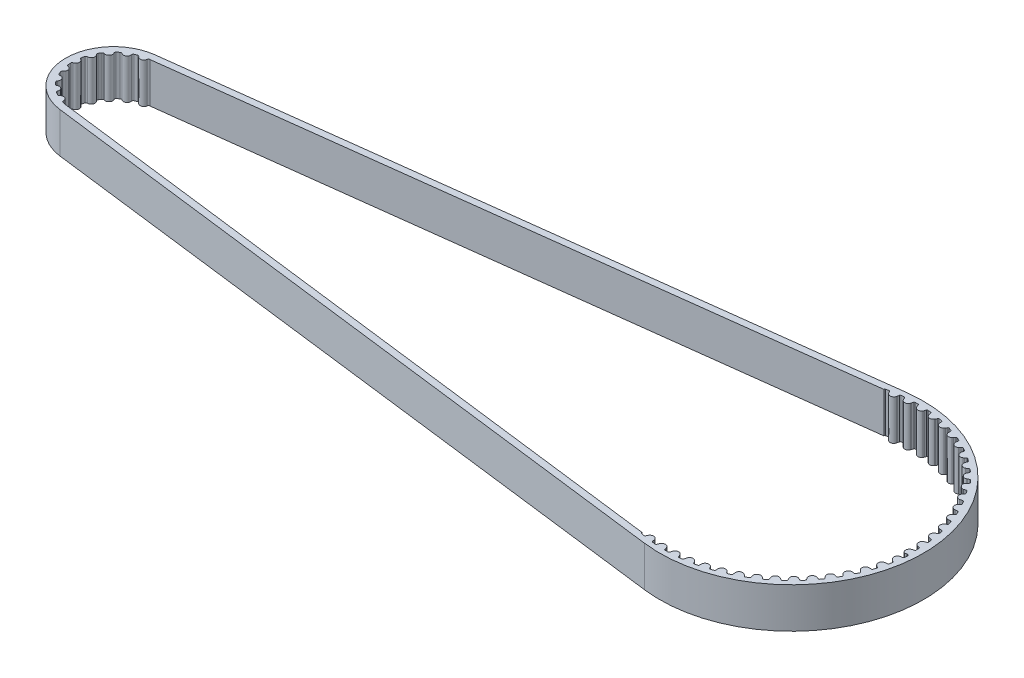
from build123d import *

# Parameters (mm, degrees)
BOSS_EXTRUDE1_DEPTH = 6


with BuildPart() as part:
    # Sketch1 → Boss-Extrude1 (new body)
    with BuildSketch(Plane(origin=(0, 0, 0), x_dir=(1, 0, 0), z_dir=(0, 1, 0))):
        with BuildLine():
            Line((98.570063965, 19.477466473), (-0.882050741, 7.070191758))
            ThreePointArc((-0.882050741, 7.070191758), (-7.125, 0), (-0.882050741, -7.070191758))
            Line((-0.882050741, -7.070191758), (98.570063965, -19.477466473))
            ThreePointArc((98.570063965, -19.477466473), (120.628456112, 0), (98.570063965, 19.477466473))
        make_face()
        with BuildLine():
            Line((96.532322207, 18.196676293), (96.5324945, 18.200875448))
            ThreePointArc((96.5324945, 18.200875448), (96.566624796, 18.290137922), (96.647734989, 18.340673087))
            ThreePointArc((96.647734989, 18.340673087), (96.85864329, 18.38944438), (97.070097766, 18.43579042))
            ThreePointArc((97.070097766, 18.43579042), (97.165040528, 18.424902897), (97.23413974, 18.358888011))
            Line((97.23413974, 18.358888011), (97.271031693, 18.288715761))
            Line((97.271031693, 18.288715761), (97.340377643, 18.156812707))
            ThreePointArc((97.340377643, 18.156812707), (97.374757011, 18.096586899), (97.413227715, 18.0388886))
            ThreePointArc((97.413227715, 18.0388886), (97.957473201, 17.815522628), (98.396741197, 18.206852582))
            ThreePointArc((98.396741197, 18.206852582), (98.413882561, 18.274048285), (98.426325649, 18.34227041))
            Line((98.426325649, 18.34227041), (98.459477503, 18.568150633))
            ThreePointArc((98.459477503, 18.568150633), (98.502751299, 18.65335653), (98.588699526, 18.695136534))
            ThreePointArc((98.588699526, 18.695136534), (98.803550437, 18.721594732), (99.018691023, 18.745583873))
            ThreePointArc((99.018691023, 18.745583873), (99.111975623, 18.724831772), (99.173795868, 18.651955687))
            Line((99.173795868, 18.651955687), (99.258329168, 18.439882488))
            ThreePointArc((99.258329168, 18.439882488), (99.28622489, 18.376392981), (99.318453734, 18.314989476))
            ThreePointArc((99.318453734, 18.314989476), (99.836369683, 18.035957982), (100.314136442, 18.379228181))
            ThreePointArc((100.314136442, 18.379228181), (100.338207768, 18.444264018), (100.357713845, 18.510811759))
            Line((100.357713845, 18.510811759), (100.414295003, 18.731989273))
            ThreePointArc((100.414295003, 18.731989273), (100.466238181, 18.812205061), (100.556082774, 18.844772153))
            ThreePointArc((100.556082774, 18.844772153), (100.772522345, 18.848627375), (100.988991916, 18.849996786))
            ThreePointArc((100.988991916, 18.849996786), (101.079596309, 18.819607471), (101.13346027, 18.740668634))
            Line((101.13346027, 18.740668634), (101.195362802, 18.520921058))
            ThreePointArc((101.195362802, 18.520921058), (101.216469248, 18.454863456), (101.242103125, 18.390427494))
            ThreePointArc((101.242103125, 18.390427494), (101.728015143, 18.058787606), (102.239046152, 18.350237109))
            ThreePointArc((102.239046152, 18.350237109), (102.269783709, 18.412400535), (102.296139063, 18.47654478))
            Line((102.296139063, 18.47654478), (102.375529608, 18.690596319))
            ThreePointArc((102.375529608, 18.690596319), (102.43557307, 18.764943136), (102.528329673, 18.787940505))
            ThreePointArc((102.528329673, 18.787940505), (102.743986546, 18.769150512), (102.959413416, 18.747885189))
            ThreePointArc((102.959413416, 18.747885189), (103.04634492, 18.708191612), (103.091662454, 18.624054893))
            Line((103.091662454, 18.624054893), (103.130256001, 18.399040541))
            ThreePointArc((103.130256001, 18.399040541), (103.144341924, 18.331138585), (103.163099983, 18.264376141))
            ThreePointArc((103.163099983, 18.264376141), (103.611684317, 17.883761373), (104.150380614, 18.120197))
            ThreePointArc((104.150380614, 18.120197), (104.187447634, 18.178806939), (104.22036351, 18.23984491))
            Line((104.22036351, 18.23984491), (104.321693624, 18.444425281))
            ThreePointArc((104.321693624, 18.444425281), (104.38917952, 18.512088567), (104.483831872, 18.525264249))
            ThreePointArc((104.483831872, 18.525264249), (104.696343265, 18.484034908), (104.908367173, 18.440367839))
            ThreePointArc((104.908367173, 18.440367839), (104.990673348, 18.391804891), (105.026947946, 18.30339211))
            Line((105.026947946, 18.30339211), (105.041809669, 18.075576286))
            ThreePointArc((105.041809669, 18.075576286), (105.048720741, 18.006573924), (105.060397466, 17.93821646))
            ThreePointArc((105.060397466, 17.93821646), (105.466739331, 17.512796909), (106.027198846, 17.691628221))
            ThreePointArc((106.027198846, 17.691628221), (106.070189215, 17.746042529), (106.10930498, 17.803305482))
            Line((106.10930498, 17.803305482), (106.231464469, 17.996173259))
            ThreePointArc((106.231464469, 17.996173259), (106.30565341, 18.056411682), (106.40116448, 18.059621321))
            ThreePointArc((106.40116448, 18.059621321), (106.608202073, 17.996404349), (106.814500041, 17.93081396))
            ThreePointArc((106.814500041, 17.93081396), (106.891279124, 17.873913707), (106.918113353, 17.782193532))
            Line((106.918113353, 17.782193532), (106.909080424, 17.554072234))
            ThreePointArc((106.909080424, 17.554072234), (106.908740926, 17.484725471), (106.913208384, 17.415521926))
            ThreePointArc((106.913208384, 17.415521926), (107.272855814, 16.949958577), (107.848938035, 17.069226261))
            ThreePointArc((107.848938035, 17.069226261), (107.897380743, 17.118848764), (107.942267836, 17.171709314))
            Line((107.942267836, 17.171709314), (108.083918295, 17.350751398))
            ThreePointArc((108.083918295, 17.350751398), (108.16399745, 17.402904972), (108.2593208, 17.396113403))
            ThreePointArc((108.2593208, 17.396113403), (108.458616247, 17.311601419), (108.65692803, 17.224806331))
            ThreePointArc((108.65692803, 17.224806331), (108.727338813, 17.160192184), (108.744438673, 17.066169521))
            Line((108.744438673, 17.066169521), (108.711610058, 16.840242094))
            ThreePointArc((108.711610058, 16.840242094), (108.704023709, 16.771310707), (108.701232953, 16.702019289))
            ThreePointArc((108.701232953, 16.702019289), (109.010245576, 16.201412952), (109.595638826, 16.259810285))
            ThreePointArc((109.595638826, 16.259810285), (109.649003124, 16.30409731), (109.699169753, 16.351976305))
            Line((109.699169753, 16.351976305), (109.85875923, 16.515231073))
            ThreePointArc((109.85875923, 16.515231073), (109.943851236, 16.558728393), (110.037942482, 16.542010026))
            ThreePointArc((110.037942482, 16.542010026), (110.227312259, 16.437128961), (110.415465113, 16.33008012))
            ThreePointArc((110.415465113, 16.33008012), (110.478736161, 16.258460005), (110.485914301, 16.163164986))
            Line((110.485914301, 16.163164986), (110.429649678, 15.941906737))
            ThreePointArc((110.429649678, 15.941906737), (110.414899596, 15.874145952), (110.404881203, 15.805525834))
            ThreePointArc((110.404881203, 15.805525834), (110.659873411, 15.275361256), (111.248163999, 15.272248426))
            ThreePointArc((111.248163999, 15.272248426), (111.305865216, 15.310714754), (111.360761745, 15.353087622))
            Line((111.360761745, 15.353087622), (111.536541744, 15.49876642))
            ThreePointArc((111.536541744, 15.49876642), (111.625714316, 15.533130921), (111.717542575, 15.506668925))
            ThreePointArc((111.717542575, 15.506668925), (111.894911908, 15.382567878), (112.07084439, 15.256438133))
            ThreePointArc((112.07084439, 15.256438133), (112.126282492, 15.178596735), (112.123460268, 15.083073432))
            Line((112.123460268, 15.083073432), (112.044376084, 14.868908514))
            ThreePointArc((112.044376084, 14.868908514), (112.022623873, 14.803060733), (112.005487607, 14.73586373))
            ThreePointArc((112.005487607, 14.73586373), (112.203665652, 14.181949506), (112.788408143, 14.117360617))
            ThreePointArc((112.788408143, 14.117360617), (112.849814093, 14.149584803), (112.908839064, 14.185987298))
            Line((112.908839064, 14.185987298), (113.098883703, 14.312494039))
            ThreePointArc((113.098883703, 14.312494039), (113.191159846, 14.337349216), (113.279719028, 14.301433515))
            ThreePointArc((113.279719028, 14.301433515), (113.443144622, 14.159472162), (113.604929179, 14.015643417))
            ThreePointArc((113.604929179, 14.015643417), (113.651926943, 13.932433583), (113.639135276, 13.83772857))
            Line((113.639135276, 13.83772857), (113.538097993, 13.633003417))
            ThreePointArc((113.538097993, 13.633003417), (113.509581977, 13.569790083), (113.485515585, 13.50475242))
            ThreePointArc((113.485515585, 13.50475242), (113.624708187, 12.933157349), (114.199496021, 12.807800051))
            ThreePointArc((114.199496021, 12.807800051), (114.263933927, 12.833429039), (114.32644065, 12.863462328))
            Line((114.32644065, 12.863462328), (114.528667759, 12.969410979))
            ThreePointArc((114.528667759, 12.969410979), (114.623036477, 12.984484513), (114.70735631, 12.939508607))
            ThreePointArc((114.70735631, 12.939508607), (114.85504764, 12.781242307), (115.000911726, 12.62129038))
            ThreePointArc((115.000911726, 12.62129038), (115.038954236, 12.533623774), (115.016333273, 12.440774657))
            Line((115.016333273, 12.440774657), (114.894449877, 12.247732283))
            ThreePointArc((114.894449877, 12.247732283), (114.760660612, 12.124247056), (114.65147794, 11.978551097))
            ThreePointArc((114.65147794, 11.978551097), (114.805196208, 11.457814978), (115.288695756, 11.210785428))
            ThreePointArc((115.288695756, 11.210785428), (115.355459624, 11.229538423), (115.420763261, 11.252873455))
            Line((115.420763261, 11.252873455), (115.632957199, 11.337103219))
            ThreePointArc((115.632957199, 11.337103219), (115.728384569, 11.342229961), (115.807541227, 11.288686615))
            ThreePointArc((115.807541227, 11.288686615), (115.937880155, 11.115849367), (116.066225653, 10.941526724))
            ThreePointArc((116.066225653, 10.941526724), (116.094896106, 10.85036384), (116.062693688, 10.760387895))
            Line((116.062693688, 10.760387895), (115.92129956, 10.581143311))
            ThreePointArc((115.92129956, 10.581143311), (115.880263895, 10.525240153), (115.843201321, 10.466627403))
            ThreePointArc((115.843201321, 10.466627403), (115.860510934, 9.878583287), (116.396675026, 9.636460236))
            ThreePointArc((116.396675026, 9.636460236), (116.465033376, 9.648131775), (116.532418449, 9.664512887))
            Line((116.532418449, 9.664512887), (116.752254374, 9.726100925))
            ThreePointArc((116.752254374, 9.726100925), (116.847694873, 9.721224706), (116.920821099, 9.659700552))
            ThreePointArc((116.920821099, 9.659700552), (117.032379604, 9.474185996), (117.141800334, 9.287402554))
            ThreePointArc((117.141800334, 9.287402554), (117.160784612, 9.193742191), (117.119353554, 9.107625213))
            Line((117.119353554, 9.107625213), (116.959997837, 8.944142261))
            ThreePointArc((116.959997837, 8.944142261), (116.913343499, 8.892834741), (116.870357257, 8.838417172))
            ThreePointArc((116.870357257, 8.838417172), (116.826104698, 8.251785075), (117.334022877, 7.954943991))
            ThreePointArc((117.334022877, 7.954943991), (117.403226761, 7.9594062), (117.471954983, 7.968653915))
            Line((117.471954983, 7.968653915), (117.697024327, 8.006925456))
            ThreePointArc((117.697024327, 8.006925456), (117.79143229, 7.992099701), (117.857726897, 7.923268811))
            ThreePointArc((117.857726897, 7.923268811), (117.949282722, 7.727109484), (118.038579848, 7.529911681))
            ThreePointArc((118.038579848, 7.529911681), (118.047669953, 7.434780002), (117.997464184, 7.353465506))
            Line((117.997464184, 7.353465506), (117.821892813, 7.207535339))
            ThreePointArc((117.821892813, 7.207535339), (117.770130956, 7.161385593), (117.721692012, 7.111759415))
            ThreePointArc((117.721692012, 7.111759415), (117.616362122, 6.532966602), (118.090469529, 6.184659738))
            ThreePointArc((118.090469529, 6.184659738), (118.159760735, 6.181863726), (118.229079106, 6.183876727))
            Line((118.229079106, 6.183876727), (118.456915962, 6.198412459))
            ThreePointArc((118.456915962, 6.198412459), (118.549257035, 6.173799602), (118.607993686, 6.098416102))
            ThreePointArc((118.607993686, 6.098416102), (118.678543725, 5.893761167), (118.746738889, 5.688309542))
            ThreePointArc((118.746738889, 5.688309542), (118.74583523, 5.592748829), (118.687404814, 5.517127715))
            Line((118.687404814, 5.517127715), (118.497541384, 5.390349174))
            ThreePointArc((118.497541384, 5.390349174), (118.441239123, 5.349862829), (118.387878184, 5.305571756))
            ThreePointArc((118.387878184, 5.305571756), (118.222624979, 4.740959603), (118.657727195, 4.345003081))
            ThreePointArc((118.657727195, 4.345003081), (118.726346553, 4.334979483), (118.795495607, 4.329735713))
            Line((118.795495607, 4.329735713), (119.023603747, 4.320376381))
            ThreePointArc((119.023603747, 4.320376381), (119.112866221, 4.286246085), (119.163401385, 4.205135892))
            ThreePointArc((119.163401385, 4.205135892), (119.212172679, 3.994227591), (119.258518719, 3.782773115))
            ThreePointArc((119.258518719, 3.782773115), (119.247631196, 3.687830353), (119.181616309, 3.618731141))
            Line((119.181616309, 3.618731141), (118.979541005, 3.512493238))
            ThreePointArc((118.979541005, 3.512493238), (118.919315198, 3.47811387), (118.861616898, 3.439643166))
            ThreePointArc((118.861616898, 3.439643166), (118.638250926, 2.89539768), (119.029580881, 2.456129684))
            ThreePointArc((119.029580881, 2.456129684), (119.096776583, 2.43898832), (119.164998709, 2.426545232))
            Line((119.164998709, 2.426545232), (119.390878931, 2.393393378))
            ThreePointArc((119.390878931, 2.393393378), (119.476084829, 2.350119582), (119.517864832, 2.264171355))
            ThreePointArc((119.517864832, 2.264171355), (119.544323031, 2.049320444), (119.568312172, 1.834179858))
            ThreePointArc((119.568312172, 1.834179858), (119.54756007, 1.740895258), (119.474683986, 1.679075013))
            Line((119.474683986, 1.679075013), (119.262610787, 1.594541713))
            ThreePointArc((119.262610787, 1.594541713), (119.19912128, 1.566645991), (119.137717774, 1.534417147))
            ThreePointArc((119.137717774, 1.534417147), (118.85868628, 1.016501198), (119.201956479, 0.538734439))
            ThreePointArc((119.201956479, 0.538734439), (119.266992317, 0.514663113), (119.333540057, 0.495157036))
            Line((119.333540057, 0.495157036), (119.554717572, 0.438575878))
            ThreePointArc((119.554717572, 0.438575878), (119.634933359, 0.3866327), (119.667500452, 0.296788107))
            ThreePointArc((119.667500452, 0.296788107), (119.671355673, 0.080348536), (119.672725084, -0.136121035))
            ThreePointArc((119.672725084, -0.136121035), (119.642335769, -0.226725428), (119.563396932, -0.280589389))
            Line((119.563396932, -0.280589389), (119.343649357, -0.342491921))
            ThreePointArc((119.343649357, -0.342491921), (119.277591755, -0.363598367), (119.213155793, -0.389232244))
            ThreePointArc((119.213155793, -0.389232244), (118.881515904, -0.875144262), (119.172965408, -1.386175271))
            ThreePointArc((119.172965408, -1.386175271), (119.338152001, -1.347427553), (119.494410264, -1.281311355))
            Line((119.494410264, -1.281311355), (119.708461804, -1.3607019))
            ThreePointArc((119.708461804, -1.3607019), (119.78280862, -1.420745362), (119.80580599, -1.513501965))
            ThreePointArc((119.80580599, -1.513501965), (119.787015996, -1.729158838), (119.765750674, -1.944585708))
            ThreePointArc((119.765750674, -1.944585708), (119.726057097, -2.031517212), (119.641920378, -2.076834746))
            Line((119.641920378, -2.076834746), (119.416906026, -2.115428292))
            ThreePointArc((119.416906026, -2.115428292), (119.34900407, -2.129514216), (119.282241625, -2.148272275))
            ThreePointArc((119.282241625, -2.148272275), (118.901626858, -2.596856609), (119.138062485, -3.135552906))
            ThreePointArc((119.138062485, -3.135552906), (119.187547628, -3.179645652), (119.23984491, -3.22036351))
            Line((119.23984491, -3.22036351), (119.444425281, -3.321693624))
            ThreePointArc((119.444425281, -3.321693624), (119.512088567, -3.38917952), (119.525264249, -3.483831872))
            ThreePointArc((119.525264249, -3.483831872), (119.484034908, -3.696343265), (119.440367839, -3.908367173))
            ThreePointArc((119.440367839, -3.908367173), (119.391804891, -3.990673348), (119.30339211, -4.026947946))
            Line((119.30339211, -4.026947946), (119.075576286, -4.041809669))
            ThreePointArc((119.075576286, -4.041809669), (119.006573924, -4.048720741), (118.93821646, -4.060397466))
            ThreePointArc((118.93821646, -4.060397466), (118.512796909, -4.466739331), (118.691628221, -5.027198846))
            ThreePointArc((118.691628221, -5.027198846), (118.746042529, -5.070189215), (118.803305482, -5.10930498))
            Line((118.803305482, -5.10930498), (118.996173259, -5.231464469))
            ThreePointArc((118.996173259, -5.231464469), (119.056411682, -5.30565341), (119.059621321, -5.40116448))
            ThreePointArc((119.059621321, -5.40116448), (118.996404349, -5.608202073), (118.93081396, -5.814500041))
            ThreePointArc((118.93081396, -5.814500041), (118.873913707, -5.891279124), (118.782193532, -5.918113353))
            Line((118.782193532, -5.918113353), (118.554072234, -5.909080424))
            ThreePointArc((118.554072234, -5.909080424), (118.484725471, -5.908740926), (118.415521926, -5.913208384))
            ThreePointArc((118.415521926, -5.913208384), (117.949958577, -6.272855814), (118.069226261, -6.848938035))
            ThreePointArc((118.069226261, -6.848938035), (118.118848764, -6.897380743), (118.171709314, -6.942267836))
            Line((118.171709314, -6.942267836), (118.350751398, -7.083918295))
            ThreePointArc((118.350751398, -7.083918295), (118.402904972, -7.16399745), (118.396113403, -7.2593208))
            ThreePointArc((118.396113403, -7.2593208), (118.311601419, -7.458616247), (118.224806331, -7.65692803))
            ThreePointArc((118.224806331, -7.65692803), (118.160192184, -7.727338813), (118.066169521, -7.744438673))
            Line((118.066169521, -7.744438673), (117.840242094, -7.711610058))
            ThreePointArc((117.840242094, -7.711610058), (117.771310707, -7.704023709), (117.702019289, -7.701232953))
            ThreePointArc((117.702019289, -7.701232953), (117.201412952, -8.010245576), (117.259810285, -8.595638826))
            ThreePointArc((117.259810285, -8.595638826), (117.30409731, -8.649003124), (117.351976305, -8.699169753))
            Line((117.351976305, -8.699169753), (117.515231073, -8.85875923))
            ThreePointArc((117.515231073, -8.85875923), (117.558728393, -8.943851236), (117.542010026, -9.037942482))
            ThreePointArc((117.542010026, -9.037942482), (117.437128961, -9.227312259), (117.33008012, -9.415465113))
            ThreePointArc((117.33008012, -9.415465113), (117.258460005, -9.478736161), (117.163164986, -9.485914301))
            Line((117.163164986, -9.485914301), (116.941906737, -9.429649678))
            ThreePointArc((116.941906737, -9.429649678), (116.874145952, -9.414899596), (116.805525834, -9.404881203))
            ThreePointArc((116.805525834, -9.404881203), (116.275361256, -9.659873411), (116.272248426, -10.248163999))
            ThreePointArc((116.272248426, -10.248163999), (116.310714754, -10.305865216), (116.353087622, -10.360761745))
            Line((116.353087622, -10.360761745), (116.49876642, -10.536541744))
            ThreePointArc((116.49876642, -10.536541744), (116.533130921, -10.625714316), (116.506668925, -10.717542575))
            ThreePointArc((116.506668925, -10.717542575), (116.382567878, -10.894911908), (116.256438133, -11.07084439))
            ThreePointArc((116.256438133, -11.07084439), (116.178596735, -11.126282492), (116.083073432, -11.123460268))
            Line((116.083073432, -11.123460268), (115.868908514, -11.044376084))
            ThreePointArc((115.868908514, -11.044376084), (115.803060733, -11.022623873), (115.73586373, -11.005487607))
            ThreePointArc((115.73586373, -11.005487607), (115.181949506, -11.203665652), (115.117360617, -11.788408143))
            ThreePointArc((115.117360617, -11.788408143), (115.149584803, -11.849814093), (115.185987298, -11.908839064))
            Line((115.185987298, -11.908839064), (115.312494039, -12.098883703))
            ThreePointArc((115.312494039, -12.098883703), (115.337349216, -12.191159846), (115.301433515, -12.279719028))
            ThreePointArc((115.301433515, -12.279719028), (115.159472162, -12.443144622), (115.015643417, -12.604929179))
            ThreePointArc((115.015643417, -12.604929179), (114.932433583, -12.651926943), (114.83772857, -12.639135276))
            Line((114.83772857, -12.639135276), (114.633003417, -12.538097993))
            ThreePointArc((114.633003417, -12.538097993), (114.569790083, -12.509581977), (114.50475242, -12.485515585))
            ThreePointArc((114.50475242, -12.485515585), (113.933157349, -12.624708187), (113.807800051, -13.199496021))
            ThreePointArc((113.807800051, -13.199496021), (113.833429039, -13.263933927), (113.863462328, -13.32644065))
            Line((113.863462328, -13.32644065), (113.969410979, -13.528667759))
            ThreePointArc((113.969410979, -13.528667759), (113.984484513, -13.623036477), (113.939508607, -13.70735631))
            ThreePointArc((113.939508607, -13.70735631), (113.781242307, -13.85504764), (113.62129038, -14.000911726))
            ThreePointArc((113.62129038, -14.000911726), (113.533623774, -14.038954236), (113.440774657, -14.016333273))
            Line((113.440774657, -14.016333273), (113.247732283, -13.894449877))
            ThreePointArc((113.247732283, -13.894449877), (113.187845973, -13.859482482), (113.125680216, -13.828749641))
            ThreePointArc((113.125680216, -13.828749641), (112.542666814, -13.907431778), (112.357914547, -14.465967457))
            ThreePointArc((112.357914547, -14.465967457), (112.376667542, -14.532731325), (112.400002574, -14.598034963))
            Line((112.400002574, -14.598034963), (112.484232338, -14.810228901))
            ThreePointArc((112.484232338, -14.810228901), (112.48935908, -14.905656271), (112.435815734, -14.984812928))
            ThreePointArc((112.435815734, -14.984812928), (112.262978486, -15.115151856), (112.088655843, -15.243497354))
            ThreePointArc((112.088655843, -15.243497354), (111.997492959, -15.272167808), (111.907517014, -15.239965389))
            Line((111.907517014, -15.239965389), (111.72827243, -15.098571261))
            ThreePointArc((111.72827243, -15.098571261), (111.672369272, -15.057535597), (111.613756522, -15.020473023))
            ThreePointArc((111.613756522, -15.020473023), (111.025712406, -15.037782635), (110.783589355, -15.573946728))
            ThreePointArc((110.783589355, -15.573946728), (110.795260894, -15.642305078), (110.811642006, -15.70969015))
            Line((110.811642006, -15.70969015), (110.873230044, -15.929526075))
            ThreePointArc((110.873230044, -15.929526075), (110.868353825, -16.024966574), (110.806829671, -16.0980928))
            ThreePointArc((110.806829671, -16.0980928), (110.621315115, -16.209651306), (110.434531673, -16.319072036))
            ThreePointArc((110.434531673, -16.319072036), (110.34087131, -16.338056313), (110.254754332, -16.296625256))
            Line((110.254754332, -16.296625256), (110.09127138, -16.137269539))
            ThreePointArc((110.09127138, -16.137269539), (110.03996386, -16.090615201), (109.985546291, -16.047628959))
            ThreePointArc((109.985546291, -16.047628959), (109.398914194, -16.0033764), (109.10207311, -16.511294578))
            ThreePointArc((109.10207311, -16.511294578), (109.106535319, -16.580498462), (109.115783034, -16.649226685))
            Line((109.115783034, -16.649226685), (109.154054575, -16.874296029))
            ThreePointArc((109.154054575, -16.874296029), (109.13922882, -16.968703991), (109.07039793, -17.034998598))
            ThreePointArc((109.07039793, -17.034998598), (108.874238603, -17.126554423), (108.6770408, -17.215851549))
            ThreePointArc((108.6770408, -17.215851549), (108.581909121, -17.224941655), (108.500594625, -17.174735886))
            Line((108.500594625, -17.174735886), (108.354664458, -16.999164514))
            ThreePointArc((108.354664458, -16.999164514), (108.308514712, -16.947402657), (108.258888534, -16.898963714))
            ThreePointArc((108.258888534, -16.898963714), (107.680095721, -16.793633823), (107.331788857, -17.267741231))
            ThreePointArc((107.331788857, -17.267741231), (107.328992845, -17.337032436), (107.331005846, -17.406350808))
            Line((107.331005846, -17.406350808), (107.345541578, -17.634187664))
            ThreePointArc((107.345541578, -17.634187664), (107.320928721, -17.726528736), (107.245545221, -17.785265387))
            ThreePointArc((107.245545221, -17.785265387), (107.040890286, -17.855815427), (106.835438661, -17.92401059))
            ThreePointArc((106.835438661, -17.92401059), (106.739877948, -17.923106931), (106.664256834, -17.864676515))
            Line((106.664256834, -17.864676515), (106.537478293, -17.674813086))
            ThreePointArc((106.537478293, -17.674813086), (106.496991948, -17.618510824), (106.452700875, -17.565149886))
            ThreePointArc((106.452700875, -17.565149886), (105.888088722, -17.39989668), (105.4921322, -17.834998896))
            ThreePointArc((105.4921322, -17.834998896), (105.482108602, -17.903618255), (105.476864832, -17.972767309))
            Line((105.476864832, -17.972767309), (105.4675055, -18.200875448))
            ThreePointArc((105.4675055, -18.200875448), (105.433375204, -18.290137922), (105.352265011, -18.340673087))
            ThreePointArc((105.352265011, -18.340673087), (105.14135671, -18.38944438), (104.929902234, -18.43579042))
            ThreePointArc((104.929902234, -18.43579042), (104.834959472, -18.424902897), (104.76586026, -18.358888011))
            Line((104.76586026, -18.358888011), (104.659622357, -18.156812707))
            ThreePointArc((104.659622357, -18.156812707), (104.625242989, -18.096586899), (104.586772285, -18.0388886))
            ThreePointArc((104.586772285, -18.0388886), (104.042526799, -17.815522628), (103.603258803, -18.206852582))
            ThreePointArc((103.603258803, -18.206852582), (103.586117439, -18.274048285), (103.573674351, -18.34227041))
            Line((103.573674351, -18.34227041), (103.540522497, -18.568150633))
            ThreePointArc((103.540522497, -18.568150633), (103.497248701, -18.65335653), (103.411300474, -18.695136534))
            ThreePointArc((103.411300474, -18.695136534), (103.196449563, -18.721594732), (102.981308977, -18.745583873))
            ThreePointArc((102.981308977, -18.745583873), (102.888024377, -18.724831772), (102.826204132, -18.651955687))
            Line((102.826204132, -18.651955687), (102.741670832, -18.439882488))
            ThreePointArc((102.741670832, -18.439882488), (102.71377511, -18.376392981), (102.681546266, -18.314989476))
            ThreePointArc((102.681546266, -18.314989476), (102.163630317, -18.035957982), (101.685863558, -18.379228181))
            ThreePointArc((101.685863558, -18.379228181), (101.661792232, -18.444264018), (101.642286155, -18.510811759))
            Line((101.642286155, -18.510811759), (101.585704997, -18.731989273))
            ThreePointArc((101.585704997, -18.731989273), (101.533761819, -18.812205061), (101.443917226, -18.844772153))
            ThreePointArc((101.443917226, -18.844772153), (101.227477655, -18.848627375), (101.011008084, -18.849996786))
            ThreePointArc((101.011008084, -18.849996786), (100.920403691, -18.819607471), (100.86653973, -18.740668634))
            Line((100.86653973, -18.740668634), (100.804637198, -18.520921058))
            ThreePointArc((100.804637198, -18.520921058), (100.783530752, -18.454863456), (100.757896875, -18.390427494))
            ThreePointArc((100.757896875, -18.390427494), (100.271984857, -18.058787606), (99.760953848, -18.350237109))
            ThreePointArc((99.760953848, -18.350237109), (99.730216291, -18.412400535), (99.703860937, -18.47654478))
            Line((99.703860937, -18.47654478), (99.624470392, -18.690596319))
            ThreePointArc((99.624470392, -18.690596319), (99.56442693, -18.764943136), (99.471670327, -18.787940505))
            ThreePointArc((99.471670327, -18.787940505), (99.256013454, -18.769150512), (99.040586584, -18.747885189))
            ThreePointArc((99.040586584, -18.747885189), (98.95365508, -18.708191612), (98.908337546, -18.624054893))
            Line((98.908337546, -18.624054893), (98.869743999, -18.399040541))
            ThreePointArc((98.869743999, -18.399040541), (98.855658076, -18.331138585), (98.836900017, -18.264376141))
            ThreePointArc((98.836900017, -18.264376141), (98.388315683, -17.883761373), (97.849619386, -18.120197))
            ThreePointArc((97.849619386, -18.120197), (97.812552366, -18.178806939), (97.77963649, -18.23984491))
            Line((97.77963649, -18.23984491), (97.721213062, -18.357798853))
            Line((97.721213062, -18.357798853), (97.678306376, -18.444425281))
            ThreePointArc((97.678306376, -18.444425281), (97.61082048, -18.512088567), (97.516168128, -18.525264249))
            ThreePointArc((97.516168128, -18.525264249), (97.303656735, -18.484034908), (97.091632827, -18.440367839))
            ThreePointArc((97.091632827, -18.440367839), (97.009326652, -18.391804891), (96.973052054, -18.30339211))
            Line((96.973052054, -18.30339211), (96.970489601, -18.264112179))
            Line((96.970489601, -18.264112179), (-1.10048064, -6.025327158))
            ThreePointArc((-1.10048064, -6.025327158), (-1.148681851, -6.03358623), (-1.19744645, -6.029900736))
            ThreePointArc((-1.19744645, -6.029900736), (-1.422830925, -5.969103088), (-1.645734959, -5.899761134))
            ThreePointArc((-1.645734959, -5.899761134), (-1.754996858, -5.823007807), (-1.791604539, -5.694597865))
            ThreePointArc((-1.791604539, -5.694597865), (-2.130356469, -5.151912879), (-2.753452272, -5.296866267))
            ThreePointArc((-2.753452272, -5.296866267), (-2.870059046, -5.361920828), (-3.001619278, -5.339092312))
            ThreePointArc((-3.001619278, -5.339092312), (-3.197156594, -5.224348257), (-3.38831341, -5.102446201))
            ThreePointArc((-3.38831341, -5.102446201), (-3.468509568, -4.995685665), (-3.463644688, -4.862248157))
            ThreePointArc((-3.463644688, -4.862248157), (-3.618118035, -4.241443962), (-4.255510419, -4.186755634))
            ThreePointArc((-4.255510419, -4.186755634), (-4.386513016, -4.212592723), (-4.504579832, -4.150227167))
            ThreePointArc((-4.504579832, -4.150227167), (-4.655089008, -3.980674732), (-4.799220137, -3.805668282))
            ThreePointArc((-4.799220137, -3.805668282), (-4.842500396, -3.679351004), (-4.796639162, -3.553947723))
            ThreePointArc((-4.796639162, -3.553947723), (-4.751712999, -2.915792958), (-5.341009556, -2.666816189))
            ThreePointArc((-5.341009556, -2.666816189), (-5.47358453, -2.650906692), (-5.566600728, -2.55510887))
            ThreePointArc((-5.566600728, -2.55510887), (-5.657348877, -2.34734503), (-5.740345759, -2.136365037))
            ThreePointArc((-5.740345759, -2.136365037), (-5.742473545, -2.00285583), (-5.660105175, -1.897762123))
            ThreePointArc((-5.660105175, -1.897762123), (-5.420177188, -1.304723824), (-5.903693465, -0.885830194))
            ThreePointArc((-5.903693465, -0.885830194), (-6.024863453, -0.829731443), (-6.083723959, -0.709878715))
            ThreePointArc((-6.083723959, -0.709878715), (-6.10582802, -0.48424084), (-6.119566342, -0.257939496))
            ThreePointArc((-6.119566342, -0.257939496), (-6.080333374, -0.130307173), (-5.969520657, -0.055810345))
            ThreePointArc((-5.969520657, -0.055810345), (-5.558076668, 0.434060769), (-5.888482725, 0.981867032))
            ThreePointArc((-5.888482725, 0.981867032), (-5.986386763, 1.0726637), (-6.005329901, 1.204839315))
            ThreePointArc((-6.005329901, 1.204839315), (-5.956626175, 1.426264216), (-5.899761134, 1.645734959))
            ThreePointArc((-5.899761134, 1.645734959), (-5.823007807, 1.754996858), (-5.694597865, 1.791604539))
            ThreePointArc((-5.694597865, 1.791604539), (-5.151912879, 2.130356469), (-5.296866267, 2.753452272))
            ThreePointArc((-5.296866267, 2.753452272), (-5.361920828, 2.870059046), (-5.339092312, 3.001619278))
            ThreePointArc((-5.339092312, 3.001619278), (-5.224348257, 3.197156594), (-5.102446201, 3.38831341))
            ThreePointArc((-5.102446201, 3.38831341), (-4.995685665, 3.468509568), (-4.862248157, 3.463644688))
            ThreePointArc((-4.862248157, 3.463644688), (-4.241443962, 3.618118035), (-4.186755634, 4.255510419))
            ThreePointArc((-4.186755634, 4.255510419), (-4.212592723, 4.386513016), (-4.150227167, 4.504579832))
            ThreePointArc((-4.150227167, 4.504579832), (-3.980674732, 4.655089008), (-3.805668282, 4.799220137))
            ThreePointArc((-3.805668282, 4.799220137), (-3.679351004, 4.842500396), (-3.553947723, 4.796639162))
            ThreePointArc((-3.553947723, 4.796639162), (-2.915792958, 4.751712999), (-2.666816189, 5.341009556))
            ThreePointArc((-2.666816189, 5.341009556), (-2.650906692, 5.47358453), (-2.55510887, 5.566600728))
            ThreePointArc((-2.55510887, 5.566600728), (-2.34734503, 5.657348877), (-2.136365037, 5.740345759))
            ThreePointArc((-2.136365037, 5.740345759), (-2.00285583, 5.742473545), (-1.897762123, 5.660105175))
            ThreePointArc((-1.897762123, 5.660105175), (-1.304723824, 5.420177188), (-0.885830194, 5.903693465))
            ThreePointArc((-0.885830194, 5.903693465), (-0.829731443, 6.024863453), (-0.709878715, 6.083723959))
            ThreePointArc((-0.709878715, 6.083723959), (-0.636793043, 6.091807582), (-0.563615595, 6.099013237))
            Line((-0.563615595, 6.099013237), (96.532322207, 18.196676293))
        make_face(mode=Mode.SUBTRACT)
    extrude(amount=BOSS_EXTRUDE1_DEPTH)


solid = part.part
